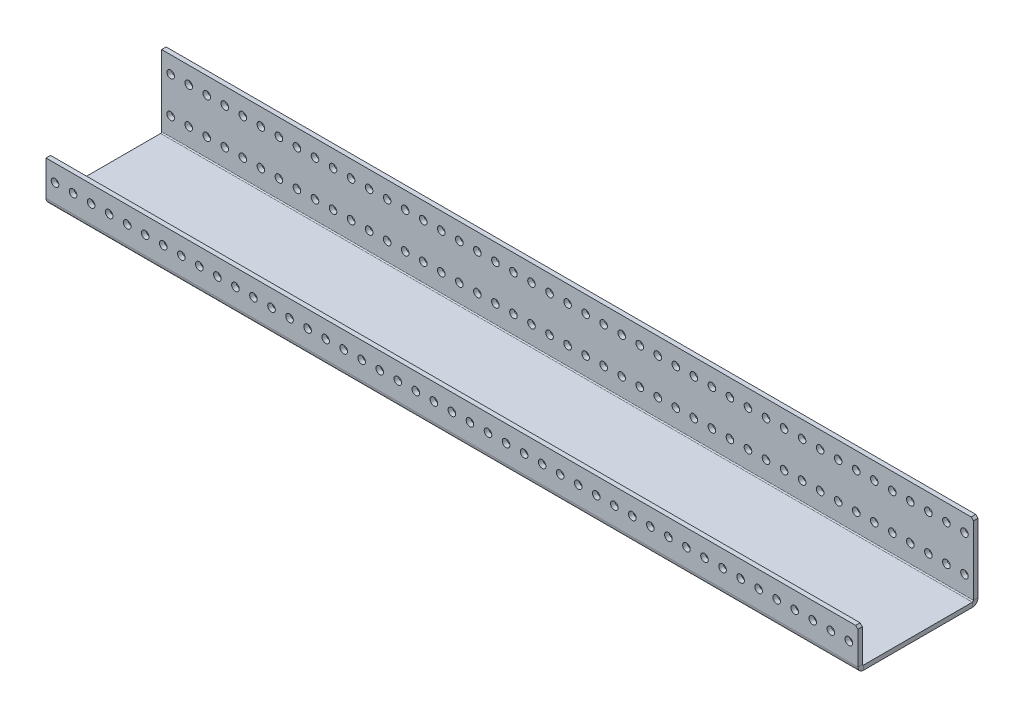
from build123d import *

# Parameters (mm, degrees)
SKETCH1_W                    = 787.4
SKETCH1_H                    = 78.232
BOSS_EXTRUDE1_DEPTH          = 3.175
EDGE_FLANGE1_STRIP_W         = 14.224
EDGE_FLANGE1_STRIP_H         = 3.175
EDGE_FLANGE1_STRIP_CUT_DEPTH = 787.4
EDGE_FLANGE1_DEPTH           = 787.4
EDGE_FLANGE2_STRIP_W         = 14.224
EDGE_FLANGE2_STRIP_H         = 3.175
EDGE_FLANGE2_STRIP_CUT_DEPTH = 787.4
EDGE_FLANGE2_DEPTH           = 787.4
SKETCH9_R                    = 2.667
CUT_EXTRUDE1_DEPTH           = 794.767078776
CHAMFER1_SIZE                = 1.5875
LPATTERN1_COUNT              = 62
LPATTERN1_PITCH              = 12.7
SKETCH10_W                   = 215.9
SKETCH10_H                   = 125.202186064
CUT_EXTRUDE2_DEPTH           = 794.767078776
SKETCH14_R                   = 2.667
CUT_EXTRUDE6_DEPTH           = 5.08
LPATTERN4_COUNT              = 62
LPATTERN4_PITCH              = 12.7


# Sheet-metal steps are written as plain solids
with BuildPart() as part:
    # Sketch1 → Boss-Extrude1 (new body)
    with BuildSketch(Plane(origin=(0, 0, 0), x_dir=(1, 0, 0), z_dir=(0, 1, 0))):
        with Locations((393.7, 39.116)):
            Rectangle(SKETCH1_W, SKETCH1_H)
    extrude(amount=BOSS_EXTRUDE1_DEPTH)

    # Edge-Flange1 strip (across the edge) → Edge-Flange1 strip cut (cut)
    with BuildSketch(Plane(origin=(787.4, 3.175, -78.232), x_dir=(0, 0, 1), z_dir=(-1, 0, 0))):
        with Locations((-6.35, -1.5875)):
            Rectangle(EDGE_FLANGE1_STRIP_W, EDGE_FLANGE1_STRIP_H)
    extrude(amount=EDGE_FLANGE1_STRIP_CUT_DEPTH, mode=Mode.SUBTRACT)

    # Edge-Flange1 section (across the edge) → Edge-Flange1 (add)
    with BuildSketch(Plane(origin=(787.4, 3.175, -78.232), x_dir=(0, 0, 1), z_dir=(-1, 0, 0))):
        with BuildLine():
            Line((-3.175, 0.762), (-3.175, 50.8))
            Line((-3.175, 50.8), (0, 50.8))
            Line((0, 50.8), (0, 0.762))
            ThreePointArc((0, 0.762), (0.223184633, 0.223184633), (0.762, 0))
            Line((0.762, 0), (0.762, -3.175))
            ThreePointArc((0.762, -3.175), (-2.021879398, -2.021879398), (-3.175, 0.762))
        make_face()
    extrude(amount=EDGE_FLANGE1_DEPTH)

    # Edge-Flange2 strip (across the edge) → Edge-Flange2 strip cut (cut)
    with BuildSketch(Plane(origin=(0, 3.175, 0), x_dir=(0, 0, -1), z_dir=(1, 0, 0))):
        with Locations((-6.35, -1.5875)):
            Rectangle(EDGE_FLANGE2_STRIP_W, EDGE_FLANGE2_STRIP_H)
    extrude(amount=EDGE_FLANGE2_STRIP_CUT_DEPTH, mode=Mode.SUBTRACT)

    # Edge-Flange2 section (across the edge) → Edge-Flange2 (add)
    with BuildSketch(Plane(origin=(0, 3.175, 0), x_dir=(0, 0, -1), z_dir=(1, 0, 0))):
        with BuildLine():
            Line((-3.175, 0.762), (-3.175, 25.4))
            Line((-3.175, 25.4), (0, 25.4))
            Line((0, 25.4), (0, 0.762))
            ThreePointArc((0, 0.762), (0.223184633, 0.223184633), (0.762, 0))
            Line((0.762, 0), (0.762, -3.175))
            ThreePointArc((0.762, -3.175), (-2.021879398, -2.021879398), (-3.175, 0.762))
        make_face()
    extrude(amount=EDGE_FLANGE2_DEPTH)

    # Sketch9 → Cut-Extrude1 (cut, through all)
    with BuildSketch(Plane.XY.offset(3.175)):
        with Locations((781.05, 16.637)):
            Circle(SKETCH9_R)
    cut_extrude1 = extrude(amount=-CUT_EXTRUDE1_DEPTH, mode=Mode.SUBTRACT)

    # Chamfer1
    chamfer1_edges = [part.edges().sort_by_distance(p)[0] for p in [
        (787.4, 53.975, -79.8195),
        (0, 53.975, -79.8195),
        (0, 28.575, 1.5875),
        (787.4, 28.575, 1.5875),
    ]]
    chamfer(chamfer1_edges, length=CHAMFER1_SIZE)

    # LPattern1: Cut-Extrude1 ×62
    with Locations(*[(-i * LPATTERN1_PITCH, 0, 0) for i in range(1, LPATTERN1_COUNT)]):
        add(cut_extrude1, mode=Mode.SUBTRACT)

    # Sketch10 → Cut-Extrude2 (cut, through all)
    with BuildSketch(Plane.XY.offset(3.175)):
        with Locations((107.95, 62.601093032)):
            Rectangle(SKETCH10_W, SKETCH10_H)
    extrude(amount=-CUT_EXTRUDE2_DEPTH, mode=Mode.SUBTRACT)

    # Sketch14 → Cut-Extrude6 (cut)
    with BuildSketch(Plane(origin=(0, 0, -81.407), x_dir=(-1, 0, 0), z_dir=(0, 0, -1))):
        with Locations(Location((-781.05, 42.037, 0), (0, 0, 90))):
            Circle(SKETCH14_R)
    cut_extrude6 = extrude(amount=-CUT_EXTRUDE6_DEPTH, mode=Mode.SUBTRACT)

    # LPattern4: Cut-Extrude6 ×62
    with Locations(*[(-i * LPATTERN4_PITCH, 0, 0) for i in range(1, LPATTERN4_COUNT)]):
        add(cut_extrude6, mode=Mode.SUBTRACT)


solid = part.part
